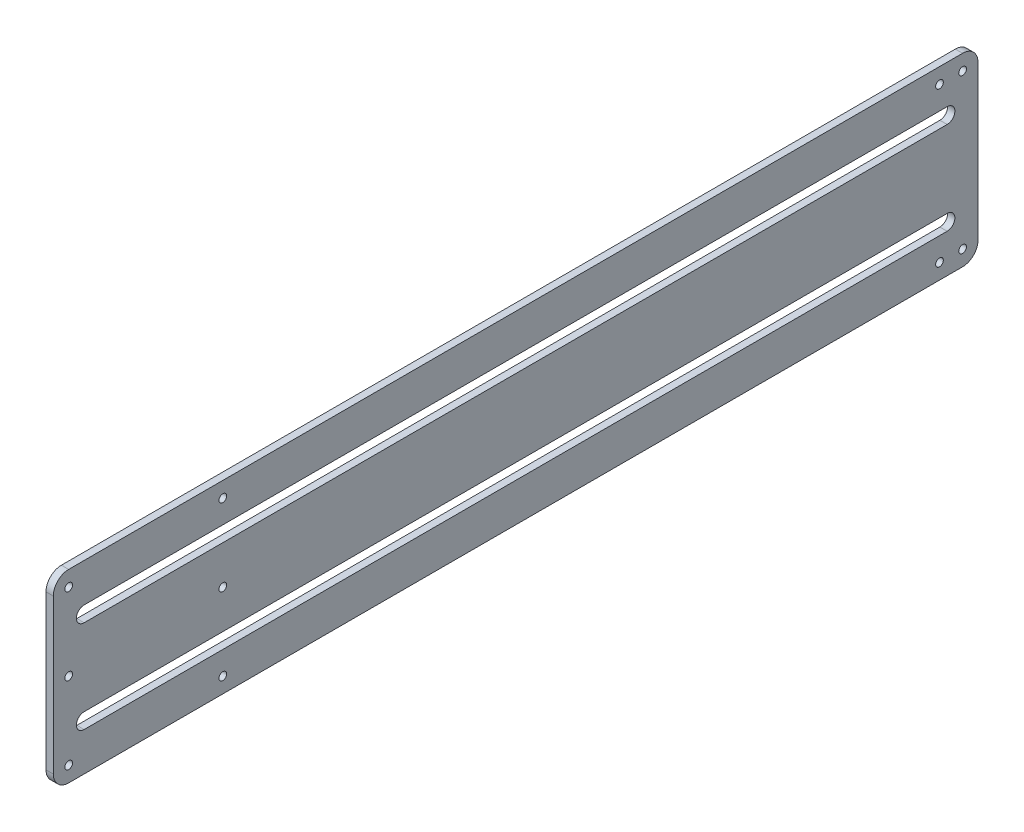
from build123d import *

# Parameters (mm, degrees)
OUTER_CUT_DEPTH    = 1.4986
SLOTS_DEPTH        = 195.295762197
SKETCH3_R          = 1.5875
MOUNT_HOLES_DEPTH  = 195.295762197
SKETCH4_R          = 1.5875
CUT_EXTRUDE1_DEPTH = 195.295762197


with BuildPart() as part:
    # Sketch1 → Outer Cut (new, symmetric)
    with BuildSketch(Plane(origin=(0, 0, 0), x_dir=(0, 0, -1), z_dir=(1, 0, 0))):
        with BuildLine():
            Line((-184.15, -38.1), (184.15, -38.1))
            ThreePointArc((184.15, -38.1), (188.640128061, -36.240128061), (190.5, -31.75))
            Line((190.5, -31.75), (190.5, 31.75))
            ThreePointArc((190.5, 31.75), (188.640128061, 36.240128061), (184.15, 38.1))
            Line((184.15, 38.1), (-184.15, 38.1))
            ThreePointArc((-184.15, 38.1), (-188.640128061, 36.240128061), (-190.5, 31.75))
            Line((-190.5, 31.75), (-190.5, -31.75))
            ThreePointArc((-190.5, -31.75), (-188.640128061, -36.240128061), (-184.15, -38.1))
        make_face()
    extrude(amount=OUTER_CUT_DEPTH, both=True)

    # Sketch2 → Slots (cut, through all)
    with BuildSketch(Plane(origin=(1.4986, 0, 0), x_dir=(0, 0, -1), z_dir=(1, 0, 0))):
        with BuildLine():
            Line((-177.8, 22.225), (177.8, 22.225))
            ThreePointArc((177.8, 22.225), (180.975, 19.05), (177.8, 15.875))
            Line((177.8, 15.875), (-177.8, 15.875))
            ThreePointArc((-177.8, 15.875), (-180.975, 19.05), (-177.8, 22.225))
        make_face()
        with BuildLine():
            Line((-177.8, -22.225), (177.8, -22.225))
            ThreePointArc((177.8, -22.225), (180.975, -19.05), (177.8, -15.875))
            Line((177.8, -15.875), (-177.8, -15.875))
            ThreePointArc((-177.8, -15.875), (-180.975, -19.05), (-177.8, -22.225))
        make_face()
    extrude(amount=-SLOTS_DEPTH, mode=Mode.SUBTRACT)

    # Sketch3 → Mount Holes (cut, through all)
    with BuildSketch(Plane(origin=(1.4986, 0, 0), x_dir=(0, 0, -1), z_dir=(1, 0, 0))):
        with Locations((-184.15, 31.75)):
            Circle(SKETCH3_R)
        with Locations((-120.65, 31.75)):
            Circle(SKETCH3_R)
        with Locations((-120.65, -31.75)):
            Circle(SKETCH3_R)
        with Locations((-184.15, -31.75)):
            Circle(SKETCH3_R)
        with Locations((-184.15, 0)):
            Circle(SKETCH3_R)
        with Locations((-120.65, 0)):
            Circle(SKETCH3_R)
    extrude(amount=-MOUNT_HOLES_DEPTH, mode=Mode.SUBTRACT)

    # Sketch4 → Cut-Extrude1 (cut, through all)
    with BuildSketch(Plane(origin=(1.4986, 0, 0), x_dir=(0, 0, -1), z_dir=(1, 0, 0))):
        with Locations((184.15, 31.75)):
            Circle(SKETCH4_R)
        with Locations((174.625, 31.75)):
            Circle(SKETCH4_R)
        with Locations((174.625, -31.75)):
            Circle(SKETCH4_R)
        with Locations((184.15, -31.75)):
            Circle(SKETCH4_R)
    extrude(amount=-CUT_EXTRUDE1_DEPTH, mode=Mode.SUBTRACT)


solid = part.part
